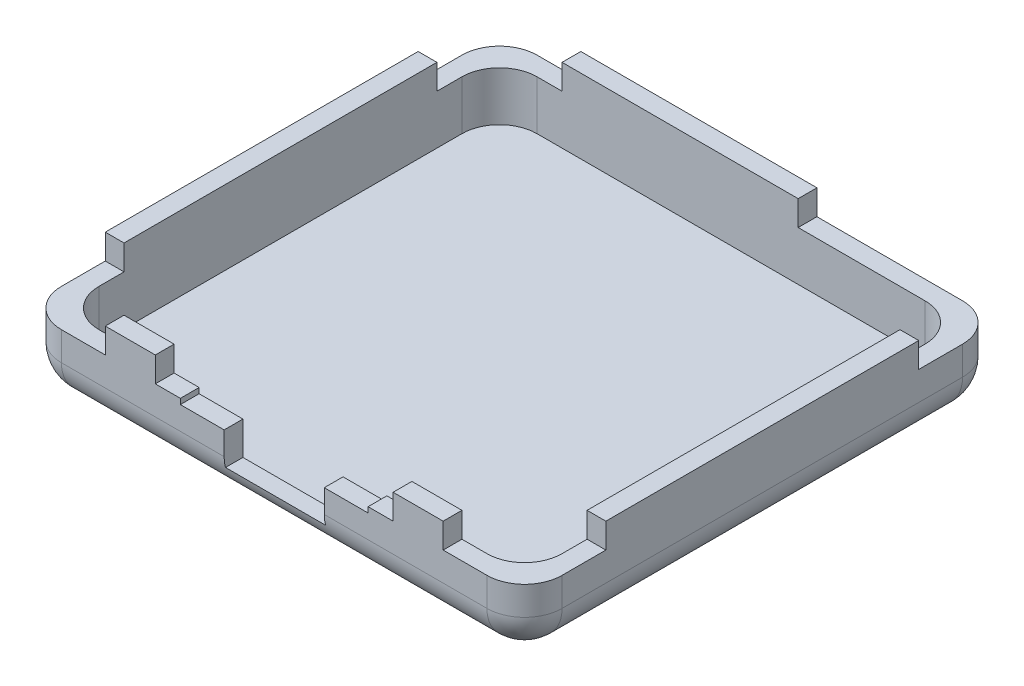
from build123d import *

# Parameters (mm, degrees)
BOSS_EXTRUDE1_DEPTH = 7.288380162
CUT_EXTRUDE3_DEPTH  = 5.938619602
SKETCH5_W           = 8
SKETCH5_H           = 2.8
SKETCH5_W_2         = 15
SKETCH5_H_2         = 1.082982858
CUT_EXTRUDE6_DEPTH  = 4
FILLET2_R           = 3
SKETCH7_W           = 19
SKETCH7_H           = 6.03347221
CUT_EXTRUDE8_DEPTH  = 2
SKETCH8_W           = 14.334368534
SKETCH8_H           = 11.344502268
SKETCH8_W_2         = 12.278418615
SKETCH8_H_2         = 17.135054821
SKETCH8_W_3         = 15.257811301
SKETCH8_H_3         = 9.410205862
SKETCH8_W_4         = 12.235138376
SKETCH8_H_4         = 13.74281341
CUT_EXTRUDE9_DEPTH  = 2
SKETCH9_W           = 12
SKETCH9_H           = 10.54511274
CUT_EXTRUDE10_DEPTH = 2


with BuildPart() as part:
    # Sketch1 → Boss-Extrude1 (new body)
    with BuildSketch(Plane(origin=(0, 0, 0), x_dir=(1, 0, 0), z_dir=(0, 1, 0))):
        with BuildLine():
            Line((-31.444201696, 30.054028384), (2.555798304, 30.054028384))
            ThreePointArc((2.555798304, 30.054028384), (4.677118648, 29.175348727), (5.555798304, 27.054028384))
            Line((5.555798304, 27.054028384), (5.555798304, -4.945971616))
            ThreePointArc((5.555798304, -4.945971616), (4.677118648, -7.06729196), (2.555798304, -7.945971616))
            Line((2.555798304, -7.945971616), (-31.444201696, -7.945971616))
            ThreePointArc((-31.444201696, -7.945971616), (-33.565522039, -7.06729196), (-34.444201696, -4.945971616))
            Line((-34.444201696, -4.945971616), (-34.444201696, 27.054028384))
            ThreePointArc((-34.444201696, 27.054028384), (-33.565522039, 29.175348727), (-31.444201696, 30.054028384))
        make_face()
    extrude(amount=BOSS_EXTRUDE1_DEPTH)

    # Sketch2 → Cut-Extrude3 (cut)
    with BuildSketch(Plane(origin=(0, 7.288380162, 0), x_dir=(1, 0, 0), z_dir=(0, 1, 0))):
        with BuildLine():
            Line((-29.944201696, 28.554028384), (1.055798304, 28.554028384))
            ThreePointArc((1.055798304, 28.554028384), (3.177118648, 27.675348727), (4.055798304, 25.554028384))
            Line((4.055798304, 25.554028384), (4.055798304, -3.445971616))
            ThreePointArc((4.055798304, -3.445971616), (3.177118648, -5.56729196), (1.055798304, -6.445971616))
            Line((1.055798304, -6.445971616), (-29.944201696, -6.445971616))
            ThreePointArc((-29.944201696, -6.445971616), (-32.065522039, -5.56729196), (-32.944201696, -3.445971616))
            Line((-32.944201696, -3.445971616), (-32.944201696, 25.554028384))
            ThreePointArc((-32.944201696, 25.554028384), (-32.065522039, 27.675348727), (-29.944201696, 28.554028384))
        make_face()
    extrude(amount=-CUT_EXTRUDE3_DEPTH, mode=Mode.SUBTRACT)

    # Sketch5 → Cut-Extrude6 (cut)
    with BuildSketch(Plane.XY.offset(7.945971616)):
        with Locations((-14.444201696, 3.597990821)):
            Rectangle(SKETCH5_W, SKETCH5_H)
        with Locations((-14.444201696, 5.396027171)):
            Rectangle(SKETCH5_W_2, SKETCH5_H_2)
    extrude(amount=-CUT_EXTRUDE6_DEPTH, mode=Mode.SUBTRACT)

    # Fillet2
    # the kernel refuses this fillet: 3 mm, written as the material it takes off along each edge
    with BuildSketch(Plane(origin=(2.555798304, 0, 7.945971616), x_dir=(0, 0, -1), z_dir=(-1, 0, 0))) as fillet2_piece_1:
        with BuildLine():
            CenterArc((FILLET2_R, -FILLET2_R), FILLET2_R, 90, 90)
            Line((0, -FILLET2_R), (-FILLET2_R * 0.02, -FILLET2_R))
            Line((-FILLET2_R * 0.02, -FILLET2_R), (-FILLET2_R * 0.02, FILLET2_R * 0.02))
            Line((-FILLET2_R * 0.02, FILLET2_R * 0.02), (FILLET2_R, FILLET2_R * 0.02))
            Line((FILLET2_R, FILLET2_R * 0.02), (FILLET2_R, 0))
        make_face()
    extrude(amount=34, mode=Mode.SUBTRACT)
    with BuildSketch(Plane(origin=(2.555798304, 0, 4.945971616), x_dir=(1, 0, 0), z_dir=(0, 0, -1))) as fillet2_piece_2:
        with BuildLine():
            CenterArc((3 - FILLET2_R, -FILLET2_R), FILLET2_R, 0, 90)
            Line((3, -FILLET2_R), (3 + FILLET2_R * 0.02, -FILLET2_R))
            Line((3 + FILLET2_R * 0.02, -FILLET2_R), (3 + FILLET2_R * 0.02, 0))
            Line((3 + FILLET2_R * 0.02, 0), (3, FILLET2_R * 0.02))
            Line((3, FILLET2_R * 0.02), (3 - FILLET2_R, FILLET2_R * 0.02))
            Line((3 - FILLET2_R, FILLET2_R * 0.02), (3 - FILLET2_R, 0))
        make_face()
    revolve(axis=Axis((2.555798304, 0, 4.945971616), (0, -1, 0)), revolution_arc=90, mode=Mode.SUBTRACT)
    with BuildSketch(Plane(origin=(5.555798304, 0, -27.054028384), x_dir=(-1, 0, 0), z_dir=(0, 0, 1)), Plane(origin=(-34.444201696, 0, 4.945971616), x_dir=(1, 0, 0), z_dir=(0, 0, -1))) as fillet2_piece_3:
        with BuildLine():
            CenterArc((FILLET2_R, -FILLET2_R), FILLET2_R, 90, 90)
            Line((0, -FILLET2_R), (-FILLET2_R * 0.02, -FILLET2_R))
            Line((-FILLET2_R * 0.02, -FILLET2_R), (-FILLET2_R * 0.02, FILLET2_R * 0.02))
            Line((-FILLET2_R * 0.02, FILLET2_R * 0.02), (FILLET2_R, FILLET2_R * 0.02))
            Line((FILLET2_R, FILLET2_R * 0.02), (FILLET2_R, 0))
        make_face()
    extrude(amount=32, mode=Mode.SUBTRACT)
    with BuildSketch(Plane(origin=(2.555798304, 0, -27.054028384), x_dir=(0, 0, -1), z_dir=(-1, 0, 0))) as fillet2_piece_4:
        with BuildLine():
            CenterArc((3 - FILLET2_R, -FILLET2_R), FILLET2_R, 0, 90)
            Line((3 - FILLET2_R, 0), (3 - FILLET2_R, FILLET2_R * 0.02))
            Line((3 - FILLET2_R, FILLET2_R * 0.02), (3, FILLET2_R * 0.02))
            Line((3, FILLET2_R * 0.02), (3 + FILLET2_R * 0.02, 0))
            Line((3 + FILLET2_R * 0.02, 0), (3 + FILLET2_R * 0.02, -FILLET2_R))
            Line((3 + FILLET2_R * 0.02, -FILLET2_R), (3, -FILLET2_R))
        make_face()
    revolve(axis=Axis((2.555798304, 0, -27.054028384), (0, -1, 0)), revolution_arc=90, mode=Mode.SUBTRACT)
    with BuildSketch(Plane(origin=(-31.444201696, 0, -30.054028384), x_dir=(0, 1, 0), z_dir=(1, 0, 0))) as fillet2_piece_5:
        with BuildLine():
            CenterArc((FILLET2_R, FILLET2_R), FILLET2_R, 180, 90)
            Line((0, FILLET2_R), (-FILLET2_R * 0.02, FILLET2_R))
            Line((-FILLET2_R * 0.02, FILLET2_R), (-FILLET2_R * 0.02, -FILLET2_R * 0.02))
            Line((-FILLET2_R * 0.02, -FILLET2_R * 0.02), (FILLET2_R, -FILLET2_R * 0.02))
            Line((FILLET2_R, -FILLET2_R * 0.02), (FILLET2_R, 0))
        make_face()
    extrude(amount=34, mode=Mode.SUBTRACT)
    with BuildSketch(Plane(origin=(-31.444201696, 0, -27.054028384), x_dir=(-1, 0, 0), z_dir=(0, 0, 1))) as fillet2_piece_6:
        with BuildLine():
            CenterArc((3 - FILLET2_R, -FILLET2_R), FILLET2_R, 0, 90)
            Line((3 - FILLET2_R, 0), (3 - FILLET2_R, FILLET2_R * 0.02))
            Line((3 - FILLET2_R, FILLET2_R * 0.02), (3, FILLET2_R * 0.02))
            Line((3, FILLET2_R * 0.02), (3 + FILLET2_R * 0.02, 0))
            Line((3 + FILLET2_R * 0.02, 0), (3 + FILLET2_R * 0.02, -FILLET2_R))
            Line((3 + FILLET2_R * 0.02, -FILLET2_R), (3, -FILLET2_R))
        make_face()
    revolve(axis=Axis((-31.444201696, 0, -27.054028384), (0, -1, 0)), revolution_arc=90, mode=Mode.SUBTRACT)
    with BuildSketch(Plane(origin=(-31.444201696, 0, 4.945971616), x_dir=(0, 0, 1), z_dir=(1, 0, 0))) as fillet2_piece_7:
        with BuildLine():
            CenterArc((3 - FILLET2_R, -FILLET2_R), FILLET2_R, 0, 90)
            Line((3, -FILLET2_R), (3 + FILLET2_R * 0.02, -FILLET2_R))
            Line((3 + FILLET2_R * 0.02, -FILLET2_R), (3 + FILLET2_R * 0.02, 0))
            Line((3 + FILLET2_R * 0.02, 0), (3, FILLET2_R * 0.02))
            Line((3, FILLET2_R * 0.02), (3 - FILLET2_R, FILLET2_R * 0.02))
            Line((3 - FILLET2_R, FILLET2_R * 0.02), (3 - FILLET2_R, 0))
        make_face()
    revolve(axis=Axis((-31.444201696, 0, 4.945971616), (0, -1, 0)), revolution_arc=90, mode=Mode.SUBTRACT)

    # Sketch7 → Cut-Extrude8 (cut)
    with BuildSketch(Plane(origin=(0, 7.288380162, 0), x_dir=(1, 0, 0), z_dir=(0, 1, 0))):
        with Locations((-14.444201696, -7.080404366)):
            Rectangle(SKETCH7_W, SKETCH7_H)
    extrude(amount=-CUT_EXTRUDE8_DEPTH, mode=Mode.SUBTRACT)

    # Sketch8 → Cut-Extrude9 (cut)
    with BuildSketch(Plane(origin=(0, 7.288380162, 0), x_dir=(1, 0, 0), z_dir=(0, 1, 0))):
        with Locations((6.222982571, -7.11822275)):
            Rectangle(SKETCH8_W, SKETCH8_H)
        with Locations((-34.083411004, -10.013499027)):
            Rectangle(SKETCH8_W_2, SKETCH8_H_2)
        with Locations((-35.573107347, 28.259131315)):
            Rectangle(SKETCH8_W_3, SKETCH8_H_3)
        with Locations((5.173367492, 30.425435089)):
            Rectangle(SKETCH8_W_4, SKETCH8_H_4)
    extrude(amount=-CUT_EXTRUDE9_DEPTH, mode=Mode.SUBTRACT)

    # Sketch9 → Cut-Extrude10 (cut)
    with BuildSketch(Plane(origin=(0, 7.288380162, 0), x_dir=(1, 0, 0), z_dir=(0, 1, 0))):
        with Locations((-3.080143155, 28.401822491)):
            Rectangle(SKETCH9_W, SKETCH9_H)
    extrude(amount=-CUT_EXTRUDE10_DEPTH, mode=Mode.SUBTRACT)


solid = part.part
